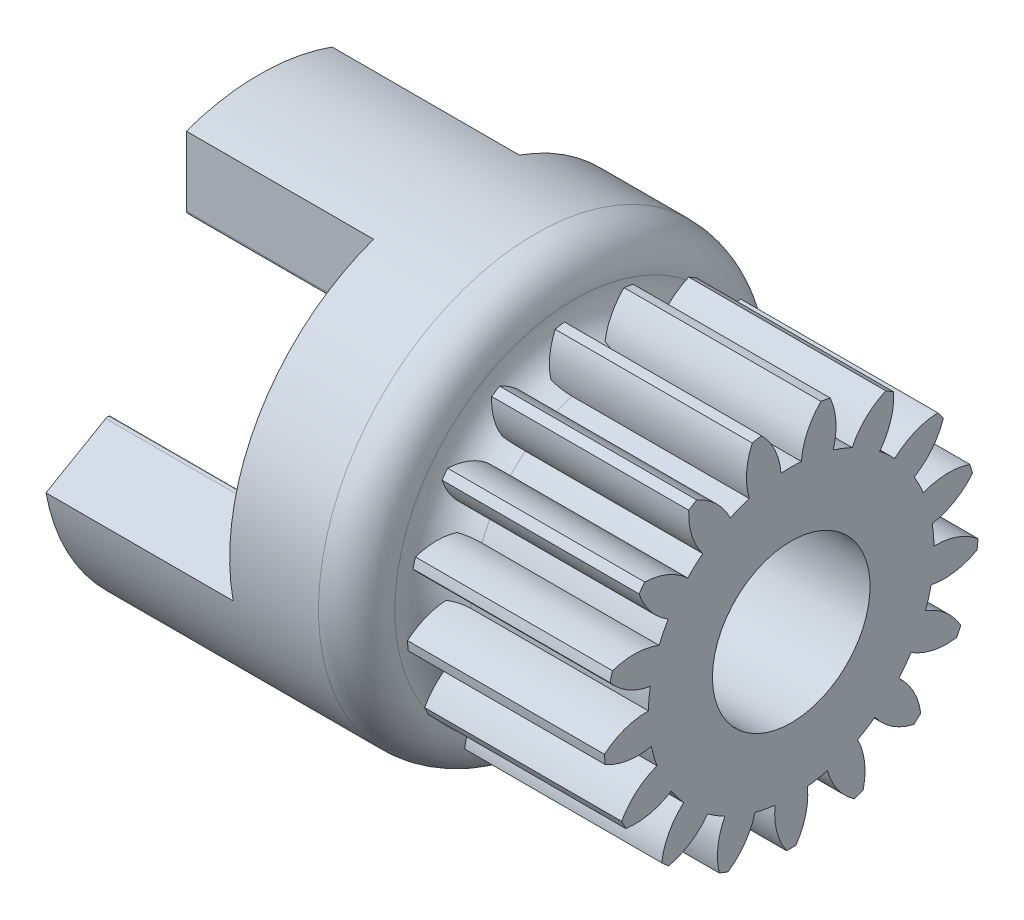
from build123d import *
from build123d.topology import SkipClean

# Parameters (mm, degrees)
BASPROSKE_W         = 10
BASPROSKE_H         = 9.5
TOOTHCUT_DEPTH      = 17.748134224
TEETHCUTS_COUNT     = 17
TEETHCUTS_ANGLE     = 338.823529412
BORSKE_R            = 4
BORE_DEPTH          = 50.0000508
EXTRUDE_START       = 1
SKETCH_3_R          = 7.249
SKETCH_3_R_2        = 4
EXTRUDE_1_DEPTH     = 1
SKETCH_4_R          = 11
EXTRUDE_2_DEPTH     = 16
CUT_EXTRUDE_2_DEPTH = 9.5
SKETCH_6_R          = 7.5
CUT_EXTRUDE_3_DEPTH = 10
FILLET_1_R          = 0.2
FILLET_2_R          = 2
FILLET_3_R          = 2


with BuildPart() as part:
    # BasProSke → Base-Revolve (revolve)
    with BuildSketch(Plane(origin=(0, 0, 0), x_dir=(1, 0, 0), z_dir=(0, 1, 0)), mode=Mode.PRIVATE) as base_revolve_sk:
        with Locations((5, 4.75)):
            Rectangle(BASPROSKE_W, BASPROSKE_H)
    revolve(base_revolve_sk.sketch.rotate(Axis((-10, 0, 0), (1, 0, 0)), 180), axis=Axis((-10, 0, 0), (1, 0, 0)))

    # TooCutSke → ToothCut (cut, through all)
    with BuildSketch(Plane(origin=(0, 0, 0), x_dir=(0, 0, -1), z_dir=(1, 0, 0))):
        with BuildLine():
            ThreePointArc((0.516861231, 7.23055015), (0, 7.249), (-0.516861231, 7.23055015))
            ThreePointArc((-0.516861231, 7.23055015), (-0.827352654, 8.408398361), (-1.533069197, 9.401220346))
            ThreePointArc((-1.533069197, 9.401220346), (0, 9.5254), (1.533069197, 9.401220346))
            ThreePointArc((1.533069197, 9.401220346), (0.827352654, 8.408398361), (0.516861231, 7.23055015))
        make_face()
    toothcut = extrude(amount=TOOTHCUT_DEPTH, mode=Mode.SUBTRACT)

    # TeethCuts: ToothCut ×17 about axis
    teethcuts_axis = Axis((-10, 0, 0), (1, 0, 0))
    for i in range(1, TEETHCUTS_COUNT):
        add(toothcut.rotate(teethcuts_axis, i * TEETHCUTS_ANGLE / (TEETHCUTS_COUNT - 1)), mode=Mode.SUBTRACT)

    # BorSke → Bore (cut, symmetric)
    with BuildSketch(Plane(origin=(0, 0, 0), x_dir=(0, 0, -1), z_dir=(1, 0, 0))):
        with Locations(Location((0, 0, 0), (0, 0, 180))):
            Circle(BORSKE_R)
    extrude(amount=BORE_DEPTH, both=True, mode=Mode.SUBTRACT)

    # Эскиз3 → Бобышка-Вытянуть1 (add)
    with SkipClean():  # the faces are left unmerged after this step: merging them gives an invalid solid
        with BuildSketch(Plane.ZY.offset(EXTRUDE_START)):
            Circle(SKETCH_3_R)
            Circle(SKETCH_3_R_2, mode=Mode.SUBTRACT)
        extrude(amount=-EXTRUDE_1_DEPTH)

    # Эскиз4 → Бобышка-Вытянуть2 (add)
    with SkipClean():  # the faces are left unmerged after this step: merging them gives an invalid solid
        with BuildSketch(Plane.ZY.offset(1)):
            Circle(SKETCH_4_R)
        extrude(amount=EXTRUDE_2_DEPTH)

    # Эскиз5 → Вырез-Вытянуть2 (cut)
    with SkipClean():  # the faces are left unmerged after this step: merging them gives an invalid solid
        with BuildSketch(Plane.ZY.offset(17)):
            with BuildLine():
                Line((-3.7, 11.271659413), (-3.7, 5.344155686))
                ThreePointArc((-3.7, 5.344155686), (-5.629165125, 3.25), (-6.478174586, 0.532216151))
                Line((-6.478174586, 0.532216151), (-11.611543395, -2.431535713))
                ThreePointArc((-11.611543395, -2.431535713), (-11.611543395, 6.703927705), (-3.7, 11.271659413))
            make_face()
            with BuildLine():
                Line((11.611543395, -2.431535713), (6.478174586, 0.532216151))
                ThreePointArc((6.478174586, 0.532216151), (5.629165125, 3.25), (3.7, 5.344155686))
                Line((3.7, 5.344155686), (3.7, 11.271659413))
                ThreePointArc((3.7, 11.271659413), (11.611543395, 6.703927705), (11.611543395, -2.431535713))
            make_face()
            with BuildLine():
                Line((-7.911543395, -8.840123701), (-2.778174586, -5.876371837))
                ThreePointArc((-2.778174586, -5.876371837), (0, -6.5), (2.778174586, -5.876371837))
                Line((2.778174586, -5.876371837), (7.911543395, -8.840123701))
                ThreePointArc((7.911543395, -8.840123701), (0, -13.407855409), (-7.911543395, -8.840123701))
            make_face()
        extrude(amount=-CUT_EXTRUDE_2_DEPTH, mode=Mode.SUBTRACT)

    # Эскиз6 → Вырез-Вытянуть3 (cut)
    with SkipClean():  # the faces are left unmerged after this step: merging them gives an invalid solid
        with BuildSketch(Plane.ZY.offset(17)):
            Circle(SKETCH_6_R)
        extrude(amount=-CUT_EXTRUDE_3_DEPTH, mode=Mode.SUBTRACT)

    # Скругление1
    fillet_1_edges = [part.edges().sort_by_distance(p)[0] for p in [
        (-12.25, -6.46619528, 3.799778757),
        (-12.25, -0.057607292, 7.499778757),
        (-12.25, -6.46619528, -3.799778757),
        (-12.25, -0.057607292, -7.499778757),
        (-12.25, 6.523802572, -3.7),
        (-12.25, 6.523802572, 3.7),
    ]]
    fillet(fillet_1_edges, radius=FILLET_1_R)

    # Скругление2
    # the kernel refuses this fillet: 2 mm, written as the material it adds along each edge
    with BuildSketch(Plane(origin=(-1, 0, 0), x_dir=(0, 0, 1), z_dir=(0, -1, 0))) as fillet_2_piece_1:
        with BuildLine():
            CenterArc((7.249 + FILLET_2_R, -FILLET_2_R), FILLET_2_R, 90, 90)
            Line((7.249, -FILLET_2_R), (7.249, 0))
            Line((7.249, 0), (7.249 + FILLET_2_R, 0))
        make_face()
    revolve(axis=Axis((-1, 0, 0), (-1, 0, 0)))

    # Скругление3
    fillet_3_edges = [part.edges().sort_by_distance(p)[0] for p in [
        (-1, 0, -11),
    ]]
    fillet(fillet_3_edges, radius=FILLET_3_R)


solid = part.part
